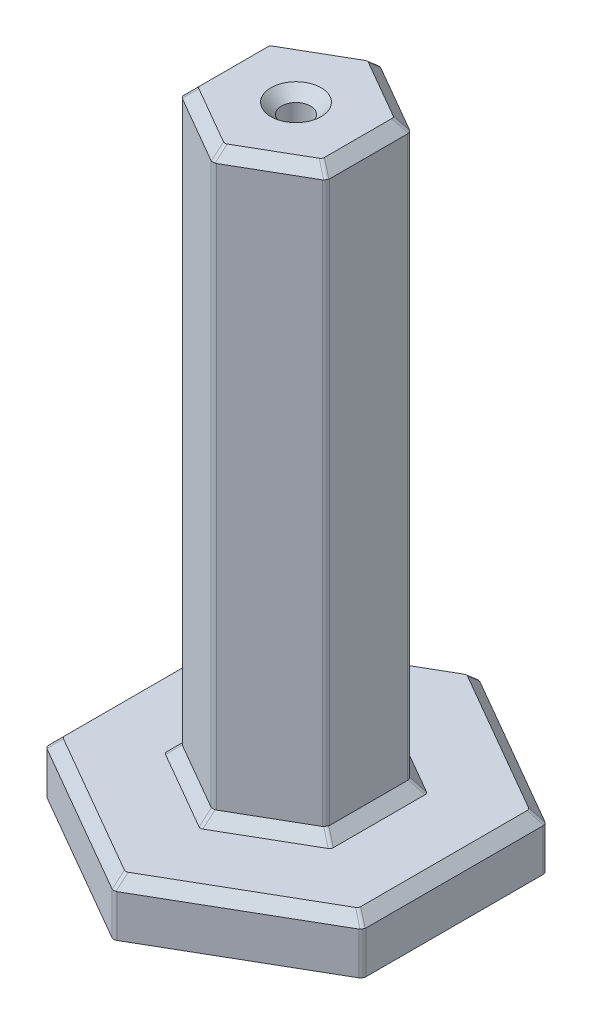
from build123d import *

# Parameters (mm, degrees)
BOSS_EXTRUDE1_DEPTH = 60
BOSS_EXTRUDE2_DEPTH = 5
SKETCH5_R           = 1.375
CUT_EXTRUDE2_DEPTH  = 15
CHAMFER1_SIZE       = 1
FILLET2_R           = 0.5


with BuildPart() as part:
    # Sketch2 → Boss-Extrude1 (new body)
    with BuildSketch(Plane(origin=(0, 0, 0), x_dir=(1, 0, 0), z_dir=(0, 1, 0))):
        Polygon((-6.875, 3.969283101), (-6.875, -3.969283101), (0, -7.938566201), (6.875, -3.969283101), (6.875, 3.969283101), (0, 7.938566201), align=None)
    extrude(amount=BOSS_EXTRUDE1_DEPTH)

    # Sketch2<3> → Boss-Extrude2 (add)
    with BuildSketch(Plane(origin=(0, 0, 0), x_dir=(1, 0, 0), z_dir=(0, 1, 0))):
        Polygon((0, -17.320508076), (15, -8.660254038), (15, 8.660254038), (0, 17.320508076), (-15, 8.660254038), (-15, -8.660254038), align=None)
        Polygon((0, -7.938566201), (6.875, -3.969283101), (6.875, 3.969283101), (0, 7.938566201), (-6.875, 3.969283101), (-6.875, -3.969283101), align=None, mode=Mode.SUBTRACT)
    extrude(amount=BOSS_EXTRUDE2_DEPTH)

    # Sketch5 → Cut-Extrude2 (cut)
    with BuildSketch(Plane(origin=(0, 60, 0), x_dir=(1, 0, 0), z_dir=(0, 1, 0))):
        with Locations(Location((0, 0, 0), (0, 0, 270))):
            Circle(SKETCH5_R)
    extrude(amount=-CUT_EXTRUDE2_DEPTH, mode=Mode.SUBTRACT)

    # Chamfer1
    chamfer1_edges = [part.edges().sort_by_distance(p)[0] for p in [
        (-3.4375, 60, 5.953924651),
        (3.4375, 60, 5.953924651),
        (6.875, 60, 0),
        (-7.5, 5, 12.990381057),
        (7.5, 5, 12.990381057),
        (15, 5, 0),
        (3.4375, 60, -5.953924651),
        (7.5, 5, -12.990381057),
        (-7.5, 5, -12.990381057),
        (-15, 5, 0),
        (-3.4375, 60, -5.953924651),
        (-3.4375, 5, 5.953924651),
        (3.4375, 5, 5.953924651),
        (6.875, 5, 0),
        (3.4375, 5, -5.953924651),
        (-3.4375, 5, -5.953924651),
        (-6.875, 5, 0),
        (0, 60, -1.375),
        (-6.875, 60, 0),
    ]]
    chamfer(chamfer1_edges, length=CHAMFER1_SIZE)

    # Fillet2
    # the kernel refuses this fillet: 0.5 mm, written as the material it takes off along each edge
    with BuildSketch(Plane(origin=(0, 4.690705213, 9.450409597), x_dir=(-0.9354143466934874, -0.26726124191242123, -0.2314550249431329), z_dir=(-2.1820492742108273e-15, 0.6546536707079779, -0.7559289460184538))) as fillet2_piece_1_section:
        with BuildLine():
            CenterArc((FILLET2_R * 0.377964473009, -FILLET2_R), FILLET2_R, 90, 41.409622109)
            Line((-FILLET2_R * 0.283473354757, -FILLET2_R * 0.25), (0, 0))
            Line((0, 0), (FILLET2_R * 0.377964473009, 0))
        make_face()
    fillet2_piece_1 = extrude(amount=2.472436414, mode=Mode.PRIVATE)
    fillet2_piece_1 = split(fillet2_piece_1, bisect_by=Plane(origin=(0.249012308, 5.466076013, 8.082333524), z_dir=(-0.4999999999999949, 0, 0.8660254037844416)), keep=Keep.TOP, mode=Mode.PRIVATE)
    fillet2_piece_1 = split(fillet2_piece_1, bisect_by=Plane(origin=(-0.249012308, 5.466076013, 8.082333524), z_dir=(0.500000000000001, 0, 0.8660254037844382)), keep=Keep.TOP, mode=Mode.PRIVATE)
    fillet2_piece_1 = split(fillet2_piece_1, bisect_by=Plane(origin=(0, 5, 8.513635494), z_dir=(0, 1, 0)), keep=Keep.TOP, mode=Mode.PRIVATE)
    add(fillet2_piece_1, mode=Mode.SUBTRACT)
    with BuildSketch(Plane(origin=(0, 4.690705213, 9.450409597), x_dir=(-0.9354143466934874, -0.26726124191242123, -0.2314550249431329), z_dir=(-2.1820492742108273e-15, 0.6546536707079779, -0.7559289460184538))) as fillet2_piece_2_section:
        with BuildLine():
            CenterArc((FILLET2_R * 0.377964473009, -FILLET2_R), FILLET2_R, 90, 41.409622109)
            Line((-FILLET2_R * 0.283473354757, -FILLET2_R * 0.25), (0, 0))
            Line((0, 0), (FILLET2_R * 0.377964473009, 0))
        make_face()
    fillet2_piece_2 = extrude(amount=2.472436414, mode=Mode.PRIVATE)
    fillet2_piece_2 = split(fillet2_piece_2, bisect_by=Plane(origin=(0.076667017, 5.950234489, 7.982829924), z_dir=(0.4999999999999949, 0, -0.8660254037844416)), keep=Keep.TOP, mode=Mode.PRIVATE)
    fillet2_piece_2 = split(fillet2_piece_2, bisect_by=Plane(origin=(0.07666702, 5.950234489, 7.894302477), z_dir=(0.500000000000001, 0, 0.8660254037844382)), keep=Keep.TOP, mode=Mode.PRIVATE)
    add(fillet2_piece_2, mode=Mode.SUBTRACT)
    with BuildSketch(Plane(origin=(0, 4.690705213, 9.450409597), x_dir=(-0.9354143466934874, -0.26726124191242123, -0.2314550249431329), z_dir=(-2.1820492742108273e-15, 0.6546536707079779, -0.7559289460184538))) as fillet2_piece_3_section:
        with BuildLine():
            CenterArc((FILLET2_R * 0.377964473009, -FILLET2_R), FILLET2_R, 90, 41.409622109)
            Line((-FILLET2_R * 0.283473354757, -FILLET2_R * 0.25), (0, 0))
            Line((0, 0), (FILLET2_R * 0.377964473009, 0))
        make_face()
    fillet2_piece_3 = extrude(amount=2.472436414, mode=Mode.PRIVATE)
    fillet2_piece_3 = split(fillet2_piece_3, bisect_by=Plane(origin=(-0.07666702, 5.950234489, 7.894302477), z_dir=(-0.4999999999999949, 0, 0.8660254037844416)), keep=Keep.TOP, mode=Mode.PRIVATE)
    fillet2_piece_3 = split(fillet2_piece_3, bisect_by=Plane(origin=(-0.076667017, 5.950234489, 7.982829924), z_dir=(-0.500000000000001, 0, -0.8660254037844382)), keep=Keep.TOP, mode=Mode.PRIVATE)
    add(fillet2_piece_3, mode=Mode.SUBTRACT)
    with BuildSketch(Plane(origin=(0, 4.690705213, -9.450409597), x_dir=(-0.9354143466934844, -0.26726124191242323, 0.23145502494314288), z_dir=(4.951573353016852e-15, 0.654653670707977, 0.7559289460184546))) as fillet2_piece_4_section:
        with BuildLine():
            CenterArc((FILLET2_R * 0.377964473009, FILLET2_R), FILLET2_R, 228.590377891, 41.409622109)
            Line((-FILLET2_R * 0.283473354757, FILLET2_R * 0.25), (0, 0))
            Line((0, 0), (FILLET2_R * 0.377964473009, 0))
        make_face()
    fillet2_piece_4 = extrude(amount=2.472436414, mode=Mode.PRIVATE)
    fillet2_piece_4 = split(fillet2_piece_4, bisect_by=Plane(origin=(0.249012308, 5.466076013, -8.082333524), z_dir=(-0.500000000000007, 0, -0.8660254037844347)), keep=Keep.TOP, mode=Mode.PRIVATE)
    fillet2_piece_4 = split(fillet2_piece_4, bisect_by=Plane(origin=(0, 5, -8.513635494), z_dir=(0, 1, 0)), keep=Keep.TOP, mode=Mode.PRIVATE)
    fillet2_piece_4 = split(fillet2_piece_4, bisect_by=Plane(origin=(-0.249012308, 5.466076013, -8.082333524), z_dir=(0.4999999999999948, 0, -0.8660254037844417)), keep=Keep.TOP, mode=Mode.PRIVATE)
    add(fillet2_piece_4, mode=Mode.SUBTRACT)
    with BuildSketch(Plane(origin=(0, 4.690705213, -9.450409597), x_dir=(-0.9354143466934844, -0.26726124191242323, 0.23145502494314288), z_dir=(4.951573353016852e-15, 0.654653670707977, 0.7559289460184546))) as fillet2_piece_5_section:
        with BuildLine():
            CenterArc((FILLET2_R * 0.377964473009, FILLET2_R), FILLET2_R, 228.590377891, 41.409622109)
            Line((-FILLET2_R * 0.283473354757, FILLET2_R * 0.25), (0, 0))
            Line((0, 0), (FILLET2_R * 0.377964473009, 0))
        make_face()
    fillet2_piece_5 = extrude(amount=2.472436414, mode=Mode.PRIVATE)
    fillet2_piece_5 = split(fillet2_piece_5, bisect_by=Plane(origin=(0.076667017, 5.950234489, -7.982829924), z_dir=(0.500000000000007, 0, 0.8660254037844347)), keep=Keep.TOP, mode=Mode.PRIVATE)
    fillet2_piece_5 = split(fillet2_piece_5, bisect_by=Plane(origin=(0.07666702, 5.950234489, -7.894302477), z_dir=(0.4999999999999948, 0, -0.8660254037844417)), keep=Keep.TOP, mode=Mode.PRIVATE)
    add(fillet2_piece_5, mode=Mode.SUBTRACT)
    with BuildSketch(Plane(origin=(0, 4.690705213, -9.450409597), x_dir=(-0.9354143466934844, -0.26726124191242323, 0.23145502494314288), z_dir=(4.951573353016852e-15, 0.654653670707977, 0.7559289460184546))) as fillet2_piece_6_section:
        with BuildLine():
            CenterArc((FILLET2_R * 0.377964473009, FILLET2_R), FILLET2_R, 228.590377891, 41.409622109)
            Line((-FILLET2_R * 0.283473354757, FILLET2_R * 0.25), (0, 0))
            Line((0, 0), (FILLET2_R * 0.377964473009, 0))
        make_face()
    fillet2_piece_6 = extrude(amount=2.472436414, mode=Mode.PRIVATE)
    fillet2_piece_6 = split(fillet2_piece_6, bisect_by=Plane(origin=(-0.07666702, 5.950234489, -7.894302477), z_dir=(-0.500000000000007, 0, -0.8660254037844347)), keep=Keep.TOP, mode=Mode.PRIVATE)
    fillet2_piece_6 = split(fillet2_piece_6, bisect_by=Plane(origin=(-0.076667017, 5.950234489, -7.982829924), z_dir=(-0.4999999999999948, 0, 0.8660254037844417)), keep=Keep.TOP, mode=Mode.PRIVATE)
    add(fillet2_piece_6, mode=Mode.SUBTRACT)
    with BuildSketch(Plane(origin=(8.184294787, 4.690705213, 4.725204798), x_dir=(-0.6681531047810594, -0.2672612419124249, 0.694365074829415), z_dir=(-0.6546536707079783, 0.6546536707079771, -0.3779644730092256))) as fillet2_piece_7_section:
        with BuildLine():
            CenterArc((FILLET2_R * 0.377964473009, -FILLET2_R), FILLET2_R, 90, 41.409622109)
            Line((-FILLET2_R * 0.283473354757, -FILLET2_R * 0.25), (0, 0))
            Line((0, 0), (FILLET2_R * 0.377964473009, 0))
        make_face()
    fillet2_piece_7 = extrude(amount=2.472436414, mode=Mode.PRIVATE)
    fillet2_piece_7 = split(fillet2_piece_7, bisect_by=Plane(origin=(7.124012308, 5.466076013, 3.825515778), z_dir=(0.500000000000001, 0, 0.8660254037844382)), keep=Keep.TOP, mode=Mode.PRIVATE)
    fillet2_piece_7 = split(fillet2_piece_7, bisect_by=Plane(origin=(7.373024616, 5, 4.256817747), z_dir=(0, 1, 0)), keep=Keep.TOP, mode=Mode.PRIVATE)
    fillet2_piece_7 = split(fillet2_piece_7, bisect_by=Plane(origin=(6.875, 5.466076013, 4.256817747), z_dir=(1, 0, 0)), keep=Keep.TOP, mode=Mode.PRIVATE)
    add(fillet2_piece_7, mode=Mode.SUBTRACT)
    with BuildSketch(Plane(origin=(8.184294787, 4.690705213, 4.725204798), x_dir=(-0.6681531047810594, -0.2672612419124249, 0.694365074829415), z_dir=(-0.6546536707079783, 0.6546536707079771, -0.3779644730092256))) as fillet2_piece_8_section:
        with BuildLine():
            CenterArc((FILLET2_R * 0.377964473009, -FILLET2_R), FILLET2_R, 90, 41.409622109)
            Line((-FILLET2_R * 0.283473354757, -FILLET2_R * 0.25), (0, 0))
            Line((0, 0), (FILLET2_R * 0.377964473009, 0))
        make_face()
    fillet2_piece_8 = extrude(amount=2.472436414, mode=Mode.PRIVATE)
    fillet2_piece_8 = split(fillet2_piece_8, bisect_by=Plane(origin=(6.951667017, 5.950234489, 3.925019378), z_dir=(-0.500000000000001, 0, -0.8660254037844382)), keep=Keep.TOP, mode=Mode.PRIVATE)
    fillet2_piece_8 = split(fillet2_piece_8, bisect_by=Plane(origin=(6.875, 5.950234489, 3.880755652), z_dir=(1, 0, 0)), keep=Keep.TOP, mode=Mode.PRIVATE)
    add(fillet2_piece_8, mode=Mode.SUBTRACT)
    with BuildSketch(Plane(origin=(8.184294787, 4.690705213, 4.725204798), x_dir=(-0.6681531047810594, -0.2672612419124249, 0.694365074829415), z_dir=(-0.6546536707079783, 0.6546536707079771, -0.3779644730092256))) as fillet2_piece_9_section:
        with BuildLine():
            CenterArc((FILLET2_R * 0.377964473009, -FILLET2_R), FILLET2_R, 90, 41.409622109)
            Line((-FILLET2_R * 0.283473354757, -FILLET2_R * 0.25), (0, 0))
            Line((0, 0), (FILLET2_R * 0.377964473009, 0))
        make_face()
    fillet2_piece_9 = extrude(amount=2.472436414, mode=Mode.PRIVATE)
    fillet2_piece_9 = split(fillet2_piece_9, bisect_by=Plane(origin=(6.79833298, 5.950234489, 4.013546825), z_dir=(0.500000000000001, 0, 0.8660254037844382)), keep=Keep.TOP, mode=Mode.PRIVATE)
    fillet2_piece_9 = split(fillet2_piece_9, bisect_by=Plane(origin=(6.875, 5.950234489, 4.057810547), z_dir=(-1, 0, 0)), keep=Keep.TOP, mode=Mode.PRIVATE)
    add(fillet2_piece_9, mode=Mode.SUBTRACT)
    with BuildSketch(Plane(origin=(8.184294787, 4.690705213, -4.725204798), x_dir=(-0.668153104781066, -0.2672612419124279, -0.6943650748294075), z_dir=(-0.6546536707079755, 0.6546536707079769, 0.3779644730092306))) as fillet2_piece_10_section:
        with BuildLine():
            CenterArc((FILLET2_R * 0.377964473009, FILLET2_R), FILLET2_R, 228.590377891, 41.409622109)
            Line((-FILLET2_R * 0.283473354757, FILLET2_R * 0.25), (0, 0))
            Line((0, 0), (FILLET2_R * 0.377964473009, 0))
        make_face()
    fillet2_piece_10 = extrude(amount=2.472436414, mode=Mode.PRIVATE)
    fillet2_piece_10 = split(fillet2_piece_10, bisect_by=Plane(origin=(7.373024616, 5, -4.256817747), z_dir=(0, 1, 0)), keep=Keep.TOP, mode=Mode.PRIVATE)
    fillet2_piece_10 = split(fillet2_piece_10, bisect_by=Plane(origin=(7.124012308, 5.466076013, -3.825515778), z_dir=(0.4999999999999948, 0, -0.8660254037844417)), keep=Keep.TOP, mode=Mode.PRIVATE)
    fillet2_piece_10 = split(fillet2_piece_10, bisect_by=Plane(origin=(6.875, 5.466076013, -4.256817747), z_dir=(1, 0, 0)), keep=Keep.TOP, mode=Mode.PRIVATE)
    add(fillet2_piece_10, mode=Mode.SUBTRACT)
    with BuildSketch(Plane(origin=(8.184294787, 4.690705213, -4.725204798), x_dir=(-0.668153104781066, -0.2672612419124279, -0.6943650748294075), z_dir=(-0.6546536707079755, 0.6546536707079769, 0.3779644730092306))) as fillet2_piece_11_section:
        with BuildLine():
            CenterArc((FILLET2_R * 0.377964473009, FILLET2_R), FILLET2_R, 228.590377891, 41.409622109)
            Line((-FILLET2_R * 0.283473354757, FILLET2_R * 0.25), (0, 0))
            Line((0, 0), (FILLET2_R * 0.377964473009, 0))
        make_face()
    fillet2_piece_11 = extrude(amount=2.472436414, mode=Mode.PRIVATE)
    fillet2_piece_11 = split(fillet2_piece_11, bisect_by=Plane(origin=(6.951667017, 5.950234489, -3.925019378), z_dir=(-0.4999999999999948, 0, 0.8660254037844417)), keep=Keep.TOP, mode=Mode.PRIVATE)
    fillet2_piece_11 = split(fillet2_piece_11, bisect_by=Plane(origin=(6.875, 5.950234489, -3.880755652), z_dir=(1, 0, 0)), keep=Keep.TOP, mode=Mode.PRIVATE)
    add(fillet2_piece_11, mode=Mode.SUBTRACT)
    with BuildSketch(Plane(origin=(8.184294787, 4.690705213, -4.725204798), x_dir=(-0.668153104781066, -0.2672612419124279, -0.6943650748294075), z_dir=(-0.6546536707079755, 0.6546536707079769, 0.3779644730092306))) as fillet2_piece_12_section:
        with BuildLine():
            CenterArc((FILLET2_R * 0.377964473009, FILLET2_R), FILLET2_R, 228.590377891, 41.409622109)
            Line((-FILLET2_R * 0.283473354757, FILLET2_R * 0.25), (0, 0))
            Line((0, 0), (FILLET2_R * 0.377964473009, 0))
        make_face()
    fillet2_piece_12 = extrude(amount=2.472436414, mode=Mode.PRIVATE)
    fillet2_piece_12 = split(fillet2_piece_12, bisect_by=Plane(origin=(6.79833298, 5.950234489, -4.013546825), z_dir=(0.4999999999999948, 0, -0.8660254037844417)), keep=Keep.TOP, mode=Mode.PRIVATE)
    fillet2_piece_12 = split(fillet2_piece_12, bisect_by=Plane(origin=(6.875, 5.950234489, -4.057810547), z_dir=(-1, 0, 0)), keep=Keep.TOP, mode=Mode.PRIVATE)
    add(fillet2_piece_12, mode=Mode.SUBTRACT)
    with BuildSketch(Plane(origin=(13.690705213, 5.309294787, -7.90433234), x_dir=(0.2672612419124219, -0.2672612419124266, 0.9258200997725515), z_dir=(0.6546536707079772, -0.6546536707079772, -0.3779644730092271)), Plane(origin=(13.690705213, 5.309294787, 7.90433234), x_dir=(-0.6681531047810609, -0.2672612419124254, 0.6943650748294132), z_dir=(0.6546536707079774, -0.6546536707079774, 0.3779644730092266)), Plane(origin=(0, 5.309294787, 15.80866468), x_dir=(-0.9354143466934843, -0.26726124191242595, -0.23145502494314005), z_dir=(0, -0.6546536707079774, 0.7559289460184544)), Plane(origin=(5.565705213, 60.309294787, 3.213361403), x_dir=(-0.6681531047810593, -0.2672612419124241, 0.6943650748294152), z_dir=(0.6546536707079782, -0.6546536707079769, 0.3779644730092261))) as fillet2_piece_13:
        with BuildLine():
            CenterArc((FILLET2_R * 0.377964473009, FILLET2_R), FILLET2_R, 228.590377891, 41.409622109)
            Line((-FILLET2_R * 0.283473354757, FILLET2_R * 0.25), (0, 0))
            Line((0, 0), (FILLET2_R * 0.377964473009, 0))
        make_face()
    extrude(amount=2.472436414, mode=Mode.SUBTRACT)
    with BuildSketch(Plane(origin=(0, 5.309294787, -15.80866468), x_dir=(-0.9354143466934823, -0.2672612419124306, 0.2314550249431426), z_dir=(0, -0.6546536707079775, -0.7559289460184543)), Plane(origin=(-13.690705213, 5.309294787, -7.90433234), x_dir=(-0.2672612419124262, -0.26726124191242145, 0.9258200997725518), z_dir=(-0.6546536707079774, -0.6546536707079773, -0.3779644730092264)), Plane(origin=(-13.690705213, 5.309294787, 7.90433234), x_dir=(0.6681531047810614, -0.26726124191242584, 0.6943650748294126), z_dir=(-0.6546536707079773, -0.6546536707079773, 0.377964473009227)), Plane(origin=(0, 58.690705213, 8.295709059), x_dir=(-0.9354143466934889, -0.2672612419124191, -0.23145502494313003), z_dir=(-2.937374022976115e-15, 0.6546536707079778, -0.7559289460184541)), Plane(origin=(5.565705213, 60.309294787, -3.213361403), x_dir=(-0.6681531047810663, -0.2672612419124284, -0.6943650748294069), z_dir=(0.6546536707079755, -0.6546536707079768, -0.37796447300923064)), Plane(origin=(-7.184294787, 58.690705213, 4.147854529), x_dir=(-0.2672612419124373, -0.26726124191241846, -0.9258200997725494), z_dir=(0.6546536707079738, 0.6546536707079778, -0.37796447300923225)), Plane(origin=(0, 60.309294787, -6.426722806), x_dir=(-0.9354143466934819, -0.26726124191242834, 0.23145502494314776), z_dir=(-5.37119821344201e-15, -0.6546536707079769, -0.7559289460184547)), Plane(origin=(-5.565705213, 60.309294787, -3.213361403), x_dir=(-0.2672612419123992, -0.2672612419124415, 0.9258200997725538), z_dir=(-0.6546536707079809, -0.6546536707079769, -0.37796447300922154))) as fillet2_piece_14:
        with BuildLine():
            CenterArc((FILLET2_R * 0.377964473009, -FILLET2_R), FILLET2_R, 90, 41.409622109)
            Line((-FILLET2_R * 0.283473354757, -FILLET2_R * 0.25), (0, 0))
            Line((0, 0), (FILLET2_R * 0.377964473009, 0))
        make_face()
    extrude(amount=2.472436414, mode=Mode.SUBTRACT)
    with BuildSketch(Plane(origin=(0, 5.278312164, -7.938566201), x_dir=(-0.8660254037844356, 0, 0.5000000000000054), z_dir=(0, 1, 0))) as fillet2_piece_15_section:
        with BuildLine():
            CenterArc((FILLET2_R * 0.57735026919, FILLET2_R), FILLET2_R, 210, 60)
            Line((-FILLET2_R * 0.288675134595, FILLET2_R * 0.5), (0, 0))
            Line((0, 0), (FILLET2_R * 0.57735026919, 0))
        make_face()
    fillet2_piece_15 = extrude(amount=54.443375673, mode=Mode.PRIVATE)
    fillet2_piece_15 = split(fillet2_piece_15, bisect_by=Plane(origin=(0.115977803, 6.104504895, -7.884854159), z_dir=(0.3535533905932788, -0.7071067811865475, 0.6123724356957917)), keep=Keep.TOP, mode=Mode.PRIVATE)
    fillet2_piece_15 = split(fillet2_piece_15, bisect_by=Plane(origin=(0.115977803, 6.038231864, -7.827460031), z_dir=(0.35355339059327007, 0.7071067811865476, -0.6123724356957966)), keep=Keep.TOP, mode=Mode.PRIVATE)
    add(fillet2_piece_15, mode=Mode.SUBTRACT)
    with BuildSketch(Plane(origin=(0, 5.278312164, -7.938566201), x_dir=(-0.8660254037844356, 0, 0.5000000000000054), z_dir=(0, 1, 0))) as fillet2_piece_16_section:
        with BuildLine():
            CenterArc((FILLET2_R * 0.57735026919, FILLET2_R), FILLET2_R, 210, 60)
            Line((-FILLET2_R * 0.288675134595, FILLET2_R * 0.5), (0, 0))
            Line((0, 0), (FILLET2_R * 0.57735026919, 0))
        make_face()
    fillet2_piece_16 = extrude(amount=54.443375673, mode=Mode.PRIVATE)
    fillet2_piece_16 = split(fillet2_piece_16, bisect_by=Plane(origin=(-0.115977803, 6.038231864, -7.827460031), z_dir=(-0.3535533905932788, 0.7071067811865475, -0.6123724356957917)), keep=Keep.TOP, mode=Mode.PRIVATE)
    fillet2_piece_16 = split(fillet2_piece_16, bisect_by=Plane(origin=(-0.115977803, 6.104504895, -7.884854159), z_dir=(-0.35355339059327007, -0.7071067811865476, 0.6123724356957966)), keep=Keep.TOP, mode=Mode.PRIVATE)
    add(fillet2_piece_16, mode=Mode.SUBTRACT)
    with BuildSketch(Plane(origin=(0, 5.278312164, -7.938566201), x_dir=(-0.8660254037844356, 0, 0.5000000000000054), z_dir=(0, 1, 0))) as fillet2_piece_17_section:
        with BuildLine():
            CenterArc((FILLET2_R * 0.57735026919, FILLET2_R), FILLET2_R, 210, 60)
            Line((-FILLET2_R * 0.288675134595, FILLET2_R * 0.5), (0, 0))
            Line((0, 0), (FILLET2_R * 0.57735026919, 0))
        make_face()
    fillet2_piece_17 = extrude(amount=54.443375673, mode=Mode.PRIVATE)
    fillet2_piece_17 = split(fillet2_piece_17, bisect_by=Plane(origin=(6.713628494, 19.481396387, 3.752294247), z_dir=(-0.3535533905932788, 0.7071067811865475, -0.6123724356957917)), keep=Keep.TOP, mode=Mode.PRIVATE)
    fillet2_piece_17 = split(fillet2_piece_17, bisect_by=Plane(origin=(-6.713628494, 19.481396387, 3.752294247), z_dir=(0.35355339059327007, 0.7071067811865476, -0.6123724356957966)), keep=Keep.TOP, mode=Mode.PRIVATE)
    add(fillet2_piece_17, mode=Mode.SUBTRACT)
    with BuildSketch(Plane(origin=(-6.875, 5.278312164, -3.969283101), x_dir=(0, 0, 1), z_dir=(0, 1, 0))) as fillet2_piece_18_section:
        with BuildLine():
            CenterArc((FILLET2_R * 0.57735026919, FILLET2_R), FILLET2_R, 210, 60)
            Line((-FILLET2_R * 0.288675134595, FILLET2_R * 0.5), (0, 0))
            Line((0, 0), (FILLET2_R * 0.57735026919, 0))
        make_face()
    fillet2_piece_18 = extrude(amount=54.443375673, mode=Mode.PRIVATE)
    fillet2_piece_18 = split(fillet2_piece_18, bisect_by=Plane(origin=(-6.770495105, 6.104504895, -4.042866803), z_dir=(0.7071067811865476, -0.7071067811865476, -7.358336291174564e-15)), keep=Keep.TOP, mode=Mode.PRIVATE)
    fillet2_piece_18 = split(fillet2_piece_18, bisect_by=Plane(origin=(-6.720790333, 6.038231864, -4.014169739), z_dir=(-0.3535533905932788, 0.7071067811865475, -0.6123724356957917)), keep=Keep.TOP, mode=Mode.PRIVATE)
    add(fillet2_piece_18, mode=Mode.SUBTRACT)
    with BuildSketch(Plane(origin=(-6.875, 5.278312164, -3.969283101), x_dir=(0, 0, 1), z_dir=(0, 1, 0))) as fillet2_piece_19_section:
        with BuildLine():
            CenterArc((FILLET2_R * 0.57735026919, FILLET2_R), FILLET2_R, 210, 60)
            Line((-FILLET2_R * 0.288675134595, FILLET2_R * 0.5), (0, 0))
            Line((0, 0), (FILLET2_R * 0.57735026919, 0))
        make_face()
    fillet2_piece_19 = extrude(amount=54.443375673, mode=Mode.PRIVATE)
    fillet2_piece_19 = split(fillet2_piece_19, bisect_by=Plane(origin=(-6.836768136, 6.038231864, -3.813290292), z_dir=(-0.7071067811865476, 0.7071067811865476, 7.358336291174564e-15)), keep=Keep.TOP, mode=Mode.PRIVATE)
    fillet2_piece_19 = split(fillet2_piece_19, bisect_by=Plane(origin=(-6.886472909, 6.104504895, -3.841987356), z_dir=(0.3535533905932788, -0.7071067811865475, 0.6123724356957917)), keep=Keep.TOP, mode=Mode.PRIVATE)
    add(fillet2_piece_19, mode=Mode.SUBTRACT)
    with BuildSketch(Plane(origin=(-6.875, 5.278312164, -3.969283101), x_dir=(0, 0, 1), z_dir=(0, 1, 0))) as fillet2_piece_20_section:
        with BuildLine():
            CenterArc((FILLET2_R * 0.57735026919, FILLET2_R), FILLET2_R, 210, 60)
            Line((-FILLET2_R * 0.288675134595, FILLET2_R * 0.5), (0, 0))
            Line((0, 0), (FILLET2_R * 0.57735026919, 0))
        make_face()
    fillet2_piece_20 = extrude(amount=54.443375673, mode=Mode.PRIVATE)
    fillet2_piece_20 = split(fillet2_piece_20, bisect_by=Plane(origin=(6.606396387, 19.481396387, -3.938025704), z_dir=(-0.7071067811865476, 0.7071067811865476, 7.358336291174564e-15)), keep=Keep.TOP, mode=Mode.PRIVATE)
    fillet2_piece_20 = split(fillet2_piece_20, bisect_by=Plane(origin=(-0.107232107, 19.481396387, 7.690319951), z_dir=(-0.3535533905932788, 0.7071067811865475, -0.6123724356957917)), keep=Keep.TOP, mode=Mode.PRIVATE)
    add(fillet2_piece_20, mode=Mode.SUBTRACT)
    with BuildSketch(Plane(origin=(6.875, 5.278312164, -3.969283101), x_dir=(-0.866025403784442, 0, -0.4999999999999941), z_dir=(0, 1, 0))) as fillet2_piece_21_section:
        with BuildLine():
            CenterArc((FILLET2_R * 0.57735026919, FILLET2_R), FILLET2_R, 210, 60)
            Line((-FILLET2_R * 0.288675134595, FILLET2_R * 0.5), (0, 0))
            Line((0, 0), (FILLET2_R * 0.57735026919, 0))
        make_face()
    fillet2_piece_21 = extrude(amount=54.443375673, mode=Mode.PRIVATE)
    fillet2_piece_21 = split(fillet2_piece_21, bisect_by=Plane(origin=(6.886472909, 6.104504895, -3.841987356), z_dir=(-0.35355339059327007, -0.7071067811865476, 0.6123724356957966)), keep=Keep.TOP, mode=Mode.PRIVATE)
    fillet2_piece_21 = split(fillet2_piece_21, bisect_by=Plane(origin=(6.836768136, 6.038231864, -3.813290292), z_dir=(0.7071067811865476, 0.7071067811865476, -2.4667946423747115e-15)), keep=Keep.TOP, mode=Mode.PRIVATE)
    add(fillet2_piece_21, mode=Mode.SUBTRACT)
    with BuildSketch(Plane(origin=(6.875, 5.278312164, -3.969283101), x_dir=(-0.866025403784442, 0, -0.4999999999999941), z_dir=(0, 1, 0))) as fillet2_piece_22_section:
        with BuildLine():
            CenterArc((FILLET2_R * 0.57735026919, FILLET2_R), FILLET2_R, 210, 60)
            Line((-FILLET2_R * 0.288675134595, FILLET2_R * 0.5), (0, 0))
            Line((0, 0), (FILLET2_R * 0.57735026919, 0))
        make_face()
    fillet2_piece_22 = extrude(amount=54.443375673, mode=Mode.PRIVATE)
    fillet2_piece_22 = split(fillet2_piece_22, bisect_by=Plane(origin=(6.720790333, 6.038231864, -4.014169739), z_dir=(0.35355339059327007, 0.7071067811865476, -0.6123724356957966)), keep=Keep.TOP, mode=Mode.PRIVATE)
    fillet2_piece_22 = split(fillet2_piece_22, bisect_by=Plane(origin=(6.770495105, 6.104504895, -4.042866803), z_dir=(-0.7071067811865476, -0.7071067811865476, 2.4667946423747115e-15)), keep=Keep.TOP, mode=Mode.PRIVATE)
    add(fillet2_piece_22, mode=Mode.SUBTRACT)
    with BuildSketch(Plane(origin=(6.875, 5.278312164, -3.969283101), x_dir=(-0.866025403784442, 0, -0.4999999999999941), z_dir=(0, 1, 0))) as fillet2_piece_23_section:
        with BuildLine():
            CenterArc((FILLET2_R * 0.57735026919, FILLET2_R), FILLET2_R, 210, 60)
            Line((-FILLET2_R * 0.288675134595, FILLET2_R * 0.5), (0, 0))
            Line((0, 0), (FILLET2_R * 0.57735026919, 0))
        make_face()
    fillet2_piece_23 = extrude(amount=54.443375673, mode=Mode.PRIVATE)
    fillet2_piece_23 = split(fillet2_piece_23, bisect_by=Plane(origin=(0.107232107, 19.481396387, 7.690319951), z_dir=(0.35355339059327007, 0.7071067811865476, -0.6123724356957966)), keep=Keep.TOP, mode=Mode.PRIVATE)
    fillet2_piece_23 = split(fillet2_piece_23, bisect_by=Plane(origin=(-6.606396387, 19.481396387, -3.938025704), z_dir=(0.7071067811865476, 0.7071067811865476, -2.4667946423747115e-15)), keep=Keep.TOP, mode=Mode.PRIVATE)
    add(fillet2_piece_23, mode=Mode.SUBTRACT)
    with BuildSketch(Plane(origin=(6.875, 5.278312164, 3.969283101), x_dir=(-0.8660254037844378, 0, 0.5000000000000014), z_dir=(0, 1, 0))) as fillet2_piece_24_section:
        with BuildLine():
            CenterArc((FILLET2_R * 0.57735026919, -FILLET2_R), FILLET2_R, 90, 60)
            Line((-FILLET2_R * 0.288675134595, -FILLET2_R * 0.5), (0, 0))
            Line((0, 0), (FILLET2_R * 0.57735026919, 0))
        make_face()
    fillet2_piece_24 = extrude(amount=54.443375673, mode=Mode.PRIVATE)
    fillet2_piece_24 = split(fillet2_piece_24, bisect_by=Plane(origin=(6.886472909, 6.104504895, 3.841987356), z_dir=(-0.3535533905932744, -0.7071067811865475, -0.6123724356957944)), keep=Keep.TOP, mode=Mode.PRIVATE)
    fillet2_piece_24 = split(fillet2_piece_24, bisect_by=Plane(origin=(6.836768136, 6.038231864, 3.813290292), z_dir=(0.7071067811865476, 0.7071067811865476, -2.4667946423747115e-15)), keep=Keep.TOP, mode=Mode.PRIVATE)
    add(fillet2_piece_24, mode=Mode.SUBTRACT)
    with BuildSketch(Plane(origin=(6.875, 5.278312164, 3.969283101), x_dir=(-0.8660254037844378, 0, 0.5000000000000014), z_dir=(0, 1, 0))) as fillet2_piece_25_section:
        with BuildLine():
            CenterArc((FILLET2_R * 0.57735026919, -FILLET2_R), FILLET2_R, 90, 60)
            Line((-FILLET2_R * 0.288675134595, -FILLET2_R * 0.5), (0, 0))
            Line((0, 0), (FILLET2_R * 0.57735026919, 0))
        make_face()
    fillet2_piece_25 = extrude(amount=54.443375673, mode=Mode.PRIVATE)
    fillet2_piece_25 = split(fillet2_piece_25, bisect_by=Plane(origin=(6.720790333, 6.038231864, 4.014169739), z_dir=(0.3535533905932744, 0.7071067811865475, 0.6123724356957944)), keep=Keep.TOP, mode=Mode.PRIVATE)
    fillet2_piece_25 = split(fillet2_piece_25, bisect_by=Plane(origin=(6.770495105, 6.104504895, 4.042866803), z_dir=(-0.7071067811865476, -0.7071067811865476, 2.4667946423747115e-15)), keep=Keep.TOP, mode=Mode.PRIVATE)
    add(fillet2_piece_25, mode=Mode.SUBTRACT)
    with BuildSketch(Plane(origin=(6.875, 5.278312164, 3.969283101), x_dir=(-0.8660254037844378, 0, 0.5000000000000014), z_dir=(0, 1, 0))) as fillet2_piece_26_section:
        with BuildLine():
            CenterArc((FILLET2_R * 0.57735026919, -FILLET2_R), FILLET2_R, 90, 60)
            Line((-FILLET2_R * 0.288675134595, -FILLET2_R * 0.5), (0, 0))
            Line((0, 0), (FILLET2_R * 0.57735026919, 0))
        make_face()
    fillet2_piece_26 = extrude(amount=54.443375673, mode=Mode.PRIVATE)
    fillet2_piece_26 = split(fillet2_piece_26, bisect_by=Plane(origin=(0.107232107, 19.481396387, -7.690319951), z_dir=(0.3535533905932744, 0.7071067811865475, 0.6123724356957944)), keep=Keep.TOP, mode=Mode.PRIVATE)
    fillet2_piece_26 = split(fillet2_piece_26, bisect_by=Plane(origin=(-6.606396387, 19.481396387, 3.938025704), z_dir=(0.7071067811865476, 0.7071067811865476, -2.4667946423747115e-15)), keep=Keep.TOP, mode=Mode.PRIVATE)
    add(fillet2_piece_26, mode=Mode.SUBTRACT)
    with BuildSketch(Plane(origin=(0, 5.278312164, 7.938566201), x_dir=(-0.8660254037844413, 0, -0.4999999999999955), z_dir=(0, 1, 0))) as fillet2_piece_27_section:
        with BuildLine():
            CenterArc((FILLET2_R * 0.57735026919, -FILLET2_R), FILLET2_R, 90, 60)
            Line((-FILLET2_R * 0.288675134595, -FILLET2_R * 0.5), (0, 0))
            Line((0, 0), (FILLET2_R * 0.57735026919, 0))
        make_face()
    fillet2_piece_27 = extrude(amount=54.443375673, mode=Mode.PRIVATE)
    fillet2_piece_27 = split(fillet2_piece_27, bisect_by=Plane(origin=(0.115977803, 6.104504895, 7.884854159), z_dir=(0.3535533905932701, -0.7071067811865477, -0.6123724356957966)), keep=Keep.TOP, mode=Mode.PRIVATE)
    fillet2_piece_27 = split(fillet2_piece_27, bisect_by=Plane(origin=(0.115977803, 6.038231864, 7.827460031), z_dir=(0.3535533905932744, 0.7071067811865475, 0.6123724356957944)), keep=Keep.TOP, mode=Mode.PRIVATE)
    add(fillet2_piece_27, mode=Mode.SUBTRACT)
    with BuildSketch(Plane(origin=(0, 5.278312164, 7.938566201), x_dir=(-0.8660254037844413, 0, -0.4999999999999955), z_dir=(0, 1, 0))) as fillet2_piece_28_section:
        with BuildLine():
            CenterArc((FILLET2_R * 0.57735026919, -FILLET2_R), FILLET2_R, 90, 60)
            Line((-FILLET2_R * 0.288675134595, -FILLET2_R * 0.5), (0, 0))
            Line((0, 0), (FILLET2_R * 0.57735026919, 0))
        make_face()
    fillet2_piece_28 = extrude(amount=54.443375673, mode=Mode.PRIVATE)
    fillet2_piece_28 = split(fillet2_piece_28, bisect_by=Plane(origin=(-0.115977803, 6.038231864, 7.827460031), z_dir=(-0.3535533905932701, 0.7071067811865477, 0.6123724356957966)), keep=Keep.TOP, mode=Mode.PRIVATE)
    fillet2_piece_28 = split(fillet2_piece_28, bisect_by=Plane(origin=(-0.115977803, 6.104504895, 7.884854159), z_dir=(-0.3535533905932744, -0.7071067811865475, -0.6123724356957944)), keep=Keep.TOP, mode=Mode.PRIVATE)
    add(fillet2_piece_28, mode=Mode.SUBTRACT)
    with BuildSketch(Plane(origin=(0, 5.278312164, 7.938566201), x_dir=(-0.8660254037844413, 0, -0.4999999999999955), z_dir=(0, 1, 0))) as fillet2_piece_29_section:
        with BuildLine():
            CenterArc((FILLET2_R * 0.57735026919, -FILLET2_R), FILLET2_R, 90, 60)
            Line((-FILLET2_R * 0.288675134595, -FILLET2_R * 0.5), (0, 0))
            Line((0, 0), (FILLET2_R * 0.57735026919, 0))
        make_face()
    fillet2_piece_29 = extrude(amount=54.443375673, mode=Mode.PRIVATE)
    fillet2_piece_29 = split(fillet2_piece_29, bisect_by=Plane(origin=(6.713628494, 19.481396387, -3.752294247), z_dir=(-0.3535533905932701, 0.7071067811865477, 0.6123724356957966)), keep=Keep.TOP, mode=Mode.PRIVATE)
    fillet2_piece_29 = split(fillet2_piece_29, bisect_by=Plane(origin=(-6.713628494, 19.481396387, -3.752294247), z_dir=(0.3535533905932744, 0.7071067811865475, 0.6123724356957944)), keep=Keep.TOP, mode=Mode.PRIVATE)
    add(fillet2_piece_29, mode=Mode.SUBTRACT)
    with BuildSketch(Plane(origin=(-6.875, 5.278312164, 3.969283101), x_dir=(0, 0, -1), z_dir=(0, 1, 0))) as fillet2_piece_30_section:
        with BuildLine():
            CenterArc((FILLET2_R * 0.57735026919, -FILLET2_R), FILLET2_R, 90, 60)
            Line((-FILLET2_R * 0.288675134595, -FILLET2_R * 0.5), (0, 0))
            Line((0, 0), (FILLET2_R * 0.57735026919, 0))
        make_face()
    fillet2_piece_30 = extrude(amount=54.443375673, mode=Mode.PRIVATE)
    fillet2_piece_30 = split(fillet2_piece_30, bisect_by=Plane(origin=(-6.770495105, 6.104504895, 4.042866803), z_dir=(0.7071067811865476, -0.7071067811865476, -7.358336291174564e-15)), keep=Keep.TOP, mode=Mode.PRIVATE)
    fillet2_piece_30 = split(fillet2_piece_30, bisect_by=Plane(origin=(-6.720790333, 6.038231864, 4.014169739), z_dir=(-0.3535533905932701, 0.7071067811865477, 0.6123724356957966)), keep=Keep.TOP, mode=Mode.PRIVATE)
    add(fillet2_piece_30, mode=Mode.SUBTRACT)
    with BuildSketch(Plane(origin=(-6.875, 5.278312164, 3.969283101), x_dir=(0, 0, -1), z_dir=(0, 1, 0))) as fillet2_piece_31_section:
        with BuildLine():
            CenterArc((FILLET2_R * 0.57735026919, -FILLET2_R), FILLET2_R, 90, 60)
            Line((-FILLET2_R * 0.288675134595, -FILLET2_R * 0.5), (0, 0))
            Line((0, 0), (FILLET2_R * 0.57735026919, 0))
        make_face()
    fillet2_piece_31 = extrude(amount=54.443375673, mode=Mode.PRIVATE)
    fillet2_piece_31 = split(fillet2_piece_31, bisect_by=Plane(origin=(-6.836768136, 6.038231864, 3.813290292), z_dir=(-0.7071067811865476, 0.7071067811865476, 7.358336291174564e-15)), keep=Keep.TOP, mode=Mode.PRIVATE)
    fillet2_piece_31 = split(fillet2_piece_31, bisect_by=Plane(origin=(-6.886472909, 6.104504895, 3.841987356), z_dir=(0.3535533905932701, -0.7071067811865477, -0.6123724356957966)), keep=Keep.TOP, mode=Mode.PRIVATE)
    add(fillet2_piece_31, mode=Mode.SUBTRACT)
    with BuildSketch(Plane(origin=(-6.875, 5.278312164, 3.969283101), x_dir=(0, 0, -1), z_dir=(0, 1, 0))) as fillet2_piece_32_section:
        with BuildLine():
            CenterArc((FILLET2_R * 0.57735026919, -FILLET2_R), FILLET2_R, 90, 60)
            Line((-FILLET2_R * 0.288675134595, -FILLET2_R * 0.5), (0, 0))
            Line((0, 0), (FILLET2_R * 0.57735026919, 0))
        make_face()
    fillet2_piece_32 = extrude(amount=54.443375673, mode=Mode.PRIVATE)
    fillet2_piece_32 = split(fillet2_piece_32, bisect_by=Plane(origin=(6.606396387, 19.481396387, 3.938025704), z_dir=(-0.7071067811865476, 0.7071067811865476, 7.358336291174564e-15)), keep=Keep.TOP, mode=Mode.PRIVATE)
    fillet2_piece_32 = split(fillet2_piece_32, bisect_by=Plane(origin=(-0.107232107, 19.481396387, -7.690319951), z_dir=(-0.3535533905932701, 0.7071067811865477, 0.6123724356957966)), keep=Keep.TOP, mode=Mode.PRIVATE)
    add(fillet2_piece_32, mode=Mode.SUBTRACT)
    with BuildSketch(Plane(origin=(-15, -0.721687836, 8.660254038), x_dir=(0.8660254037844382, 0, 0.5000000000000006), z_dir=(0, 1, 0)), Plane(origin=(-15, -0.721687836, -8.660254038), x_dir=(0, 0, 1), z_dir=(0, 1, 0)), Plane(origin=(0, -0.721687836, -17.320508076), x_dir=(-0.8660254037844393, 0, 0.4999999999999987), z_dir=(0, 1, 0))) as fillet2_piece_33:
        with BuildLine():
            CenterArc((FILLET2_R * 0.57735026919, FILLET2_R), FILLET2_R, 210, 60)
            Line((-FILLET2_R * 0.288675134595, FILLET2_R * 0.5), (0, 0))
            Line((0, 0), (FILLET2_R * 0.57735026919, 0))
        make_face()
    extrude(amount=5.443375673, mode=Mode.SUBTRACT)
    with BuildSketch(Plane(origin=(15, -0.721687836, -8.660254038), x_dir=(0, 0, 1), z_dir=(0, 1, 0)), Plane(origin=(15, -0.721687836, 8.660254038), x_dir=(-0.8660254037844382, 0, 0.5000000000000006), z_dir=(0, 1, 0)), Plane(origin=(0, -0.721687836, 17.320508076), x_dir=(-0.8660254037844393, 0, -0.4999999999999987), z_dir=(0, 1, 0))) as fillet2_piece_34:
        with BuildLine():
            CenterArc((FILLET2_R * 0.57735026919, -FILLET2_R), FILLET2_R, 90, 60)
            Line((-FILLET2_R * 0.288675134595, -FILLET2_R * 0.5), (0, 0))
            Line((0, 0), (FILLET2_R * 0.57735026919, 0))
        make_face()
    extrude(amount=5.443375673, mode=Mode.SUBTRACT)
    with BuildSketch(Plane(origin=(-8.184294787, 4.690705213, 4.725204798), x_dir=(-0.26726124191243283, -0.26726124191242345, -0.9258200997725493), z_dir=(0.6546536707079736, 0.6546536707079776, -0.3779644730092325))) as fillet2_piece_35_section:
        with BuildLine():
            CenterArc((FILLET2_R * 0.377964473009, -FILLET2_R), FILLET2_R, 90, 41.409622109)
            Line((-FILLET2_R * 0.283473354757, -FILLET2_R * 0.25), (0, 0))
            Line((0, 0), (FILLET2_R * 0.377964473009, 0))
        make_face()
    fillet2_piece_35 = extrude(amount=2.472436414, mode=Mode.PRIVATE)
    fillet2_piece_35 = split(fillet2_piece_35, bisect_by=Plane(origin=(-6.875, 5.466076013, 4.256817747), z_dir=(-1, 0, 0)), keep=Keep.TOP, mode=Mode.PRIVATE)
    fillet2_piece_35 = split(fillet2_piece_35, bisect_by=Plane(origin=(-7.124012308, 5.466076013, 3.825515778), z_dir=(-0.4999999999999949, 0, 0.8660254037844416)), keep=Keep.TOP, mode=Mode.PRIVATE)
    fillet2_piece_35 = split(fillet2_piece_35, bisect_by=Plane(origin=(-7.373024616, 5, 4.256817747), z_dir=(0, 1, 0)), keep=Keep.TOP, mode=Mode.PRIVATE)
    add(fillet2_piece_35, mode=Mode.SUBTRACT)
    with BuildSketch(Plane(origin=(-8.184294787, 4.690705213, 4.725204798), x_dir=(-0.26726124191243283, -0.26726124191242345, -0.9258200997725493), z_dir=(0.6546536707079736, 0.6546536707079776, -0.3779644730092325))) as fillet2_piece_36_section:
        with BuildLine():
            CenterArc((FILLET2_R * 0.377964473009, -FILLET2_R), FILLET2_R, 90, 41.409622109)
            Line((-FILLET2_R * 0.283473354757, -FILLET2_R * 0.25), (0, 0))
            Line((0, 0), (FILLET2_R * 0.377964473009, 0))
        make_face()
    fillet2_piece_36 = extrude(amount=2.472436414, mode=Mode.PRIVATE)
    fillet2_piece_36 = split(fillet2_piece_36, bisect_by=Plane(origin=(-6.875, 5.950234489, 4.057810547), z_dir=(1, 0, 0)), keep=Keep.TOP, mode=Mode.PRIVATE)
    fillet2_piece_36 = split(fillet2_piece_36, bisect_by=Plane(origin=(-6.79833298, 5.950234489, 4.013546825), z_dir=(-0.4999999999999949, 0, 0.8660254037844416)), keep=Keep.TOP, mode=Mode.PRIVATE)
    add(fillet2_piece_36, mode=Mode.SUBTRACT)
    with BuildSketch(Plane(origin=(-8.184294787, 4.690705213, 4.725204798), x_dir=(-0.26726124191243283, -0.26726124191242345, -0.9258200997725493), z_dir=(0.6546536707079736, 0.6546536707079776, -0.3779644730092325))) as fillet2_piece_37_section:
        with BuildLine():
            CenterArc((FILLET2_R * 0.377964473009, -FILLET2_R), FILLET2_R, 90, 41.409622109)
            Line((-FILLET2_R * 0.283473354757, -FILLET2_R * 0.25), (0, 0))
            Line((0, 0), (FILLET2_R * 0.377964473009, 0))
        make_face()
    fillet2_piece_37 = extrude(amount=2.472436414, mode=Mode.PRIVATE)
    fillet2_piece_37 = split(fillet2_piece_37, bisect_by=Plane(origin=(-6.875, 5.950234489, 3.880755652), z_dir=(-1, 0, 0)), keep=Keep.TOP, mode=Mode.PRIVATE)
    fillet2_piece_37 = split(fillet2_piece_37, bisect_by=Plane(origin=(-6.951667017, 5.950234489, 3.925019378), z_dir=(0.4999999999999949, 0, -0.8660254037844416)), keep=Keep.TOP, mode=Mode.PRIVATE)
    add(fillet2_piece_37, mode=Mode.SUBTRACT)
    with BuildSketch(Plane(origin=(-8.184294787, 4.690705213, -4.725204798), x_dir=(-0.2672612419124129, -0.267261241912427, 0.925820099772554), z_dir=(0.654653670707981, 0.6546536707079771, 0.37796447300922104))) as fillet2_piece_38_section:
        with BuildLine():
            CenterArc((FILLET2_R * 0.377964473009, FILLET2_R), FILLET2_R, 228.590377891, 41.409622109)
            Line((-FILLET2_R * 0.283473354757, FILLET2_R * 0.25), (0, 0))
            Line((0, 0), (FILLET2_R * 0.377964473009, 0))
        make_face()
    fillet2_piece_38 = extrude(amount=2.472436414, mode=Mode.PRIVATE)
    fillet2_piece_38 = split(fillet2_piece_38, bisect_by=Plane(origin=(-6.875, 5.466076013, -4.256817747), z_dir=(-1, 0, 0)), keep=Keep.TOP, mode=Mode.PRIVATE)
    fillet2_piece_38 = split(fillet2_piece_38, bisect_by=Plane(origin=(-7.373024616, 5, -4.256817747), z_dir=(0, 1, 0)), keep=Keep.TOP, mode=Mode.PRIVATE)
    fillet2_piece_38 = split(fillet2_piece_38, bisect_by=Plane(origin=(-7.124012308, 5.466076013, -3.825515778), z_dir=(-0.500000000000007, 0, -0.8660254037844347)), keep=Keep.TOP, mode=Mode.PRIVATE)
    add(fillet2_piece_38, mode=Mode.SUBTRACT)
    with BuildSketch(Plane(origin=(-8.184294787, 4.690705213, -4.725204798), x_dir=(-0.2672612419124129, -0.267261241912427, 0.925820099772554), z_dir=(0.654653670707981, 0.6546536707079771, 0.37796447300922104))) as fillet2_piece_39_section:
        with BuildLine():
            CenterArc((FILLET2_R * 0.377964473009, FILLET2_R), FILLET2_R, 228.590377891, 41.409622109)
            Line((-FILLET2_R * 0.283473354757, FILLET2_R * 0.25), (0, 0))
            Line((0, 0), (FILLET2_R * 0.377964473009, 0))
        make_face()
    fillet2_piece_39 = extrude(amount=2.472436414, mode=Mode.PRIVATE)
    fillet2_piece_39 = split(fillet2_piece_39, bisect_by=Plane(origin=(-6.875, 5.950234489, -4.057810547), z_dir=(1, 0, 0)), keep=Keep.TOP, mode=Mode.PRIVATE)
    fillet2_piece_39 = split(fillet2_piece_39, bisect_by=Plane(origin=(-6.79833298, 5.950234489, -4.013546825), z_dir=(-0.500000000000007, 0, -0.8660254037844347)), keep=Keep.TOP, mode=Mode.PRIVATE)
    add(fillet2_piece_39, mode=Mode.SUBTRACT)
    with BuildSketch(Plane(origin=(-8.184294787, 4.690705213, -4.725204798), x_dir=(-0.2672612419124129, -0.267261241912427, 0.925820099772554), z_dir=(0.654653670707981, 0.6546536707079771, 0.37796447300922104))) as fillet2_piece_40_section:
        with BuildLine():
            CenterArc((FILLET2_R * 0.377964473009, FILLET2_R), FILLET2_R, 228.590377891, 41.409622109)
            Line((-FILLET2_R * 0.283473354757, FILLET2_R * 0.25), (0, 0))
            Line((0, 0), (FILLET2_R * 0.377964473009, 0))
        make_face()
    fillet2_piece_40 = extrude(amount=2.472436414, mode=Mode.PRIVATE)
    fillet2_piece_40 = split(fillet2_piece_40, bisect_by=Plane(origin=(-6.875, 5.950234489, -3.880755652), z_dir=(-1, 0, 0)), keep=Keep.TOP, mode=Mode.PRIVATE)
    fillet2_piece_40 = split(fillet2_piece_40, bisect_by=Plane(origin=(-6.951667017, 5.950234489, -3.925019378), z_dir=(0.500000000000007, 0, 0.8660254037844347)), keep=Keep.TOP, mode=Mode.PRIVATE)
    add(fillet2_piece_40, mode=Mode.SUBTRACT)
    with BuildSketch(Plane(origin=(0, 5.278312164, 7.938566201), x_dir=(-0.8660254037844413, 0, -0.4999999999999955), z_dir=(0, 1, 0))) as fillet2_piece_41a_section:
        with BuildLine():
            CenterArc((FILLET2_R * 0.57735026919, -FILLET2_R), FILLET2_R, 90, 60)
            Line((-FILLET2_R * 0.288675134595, -FILLET2_R * 0.5), (0, 0))
            Line((0, 0), (FILLET2_R * 0.57735026919, 0))
        make_face()
    fillet2_piece_41a = extrude(amount=54.443375673, mode=Mode.PRIVATE)
    fillet2_piece_41a = split(fillet2_piece_41a, bisect_by=Plane(origin=(-0.102115695, 5.84992161, 8.052905275), z_dir=(0.3535533905932701, -0.7071067811865477, -0.6123724356957966)), keep=Keep.TOP, mode=Mode.PRIVATE)
    fillet2_piece_41a = split(fillet2_piece_41a, bisect_by=Plane(origin=(0.102115695, 5.84992161, 8.052905275), z_dir=(-0.3535533905932744, -0.7071067811865475, -0.6123724356957944)), keep=Keep.TOP, mode=Mode.PRIVATE)
    with BuildSketch(Plane(origin=(0, 4.690705213, 9.450409597), x_dir=(-0.9354143466934874, -0.26726124191242123, -0.2314550249431329), z_dir=(-2.1820492742108273e-15, 0.6546536707079779, -0.7559289460184538))) as fillet2_piece_41b_section:
        with BuildLine():
            CenterArc((FILLET2_R * 0.377964473009, -FILLET2_R), FILLET2_R, 90, 41.409622109)
            Line((-FILLET2_R * 0.283473354757, -FILLET2_R * 0.25), (0, 0))
            Line((0, 0), (FILLET2_R * 0.377964473009, 0))
        make_face()
    fillet2_piece_41b = extrude(amount=2.472436414, mode=Mode.PRIVATE)
    fillet2_piece_41b = split(fillet2_piece_41b, bisect_by=Plane(origin=(-0.089088745, 6.142182622, 7.887130791), z_dir=(0.4999999999999949, 0, -0.8660254037844416)), keep=Keep.TOP, mode=Mode.PRIVATE)
    fillet2_piece_41b = split(fillet2_piece_41b, bisect_by=Plane(origin=(0.089088745, 6.142182622, 7.887130791), z_dir=(-0.500000000000001, 0, -0.8660254037844382)), keep=Keep.TOP, mode=Mode.PRIVATE)
    fillet2_piece_41 = fillet2_piece_41a & fillet2_piece_41b
    add(fillet2_piece_41, mode=Mode.SUBTRACT)
    with BuildSketch(Plane(origin=(0, 5.278312164, -7.938566201), x_dir=(-0.8660254037844356, 0, 0.5000000000000054), z_dir=(0, 1, 0))) as fillet2_piece_42a_section:
        with BuildLine():
            CenterArc((FILLET2_R * 0.57735026919, FILLET2_R), FILLET2_R, 210, 60)
            Line((-FILLET2_R * 0.288675134595, FILLET2_R * 0.5), (0, 0))
            Line((0, 0), (FILLET2_R * 0.57735026919, 0))
        make_face()
    fillet2_piece_42a = extrude(amount=54.443375673, mode=Mode.PRIVATE)
    fillet2_piece_42a = split(fillet2_piece_42a, bisect_by=Plane(origin=(-0.102115695, 5.84992161, -8.052905275), z_dir=(0.3535533905932788, -0.7071067811865475, 0.6123724356957917)), keep=Keep.TOP, mode=Mode.PRIVATE)
    fillet2_piece_42a = split(fillet2_piece_42a, bisect_by=Plane(origin=(0.102115695, 5.84992161, -8.052905275), z_dir=(-0.35355339059327007, -0.7071067811865476, 0.6123724356957966)), keep=Keep.TOP, mode=Mode.PRIVATE)
    with BuildSketch(Plane(origin=(0, 4.690705213, -9.450409597), x_dir=(-0.9354143466934844, -0.26726124191242323, 0.23145502494314288), z_dir=(4.951573353016852e-15, 0.654653670707977, 0.7559289460184546))) as fillet2_piece_42b_section:
        with BuildLine():
            CenterArc((FILLET2_R * 0.377964473009, FILLET2_R), FILLET2_R, 228.590377891, 41.409622109)
            Line((-FILLET2_R * 0.283473354757, FILLET2_R * 0.25), (0, 0))
            Line((0, 0), (FILLET2_R * 0.377964473009, 0))
        make_face()
    fillet2_piece_42b = extrude(amount=2.472436414, mode=Mode.PRIVATE)
    fillet2_piece_42b = split(fillet2_piece_42b, bisect_by=Plane(origin=(-0.089088745, 6.142182622, -7.887130791), z_dir=(0.500000000000007, 0, 0.8660254037844347)), keep=Keep.TOP, mode=Mode.PRIVATE)
    fillet2_piece_42b = split(fillet2_piece_42b, bisect_by=Plane(origin=(0.089088745, 6.142182622, -7.887130791), z_dir=(-0.4999999999999948, 0, 0.8660254037844417)), keep=Keep.TOP, mode=Mode.PRIVATE)
    fillet2_piece_42 = fillet2_piece_42a & fillet2_piece_42b
    add(fillet2_piece_42, mode=Mode.SUBTRACT)
    with BuildSketch(Plane(origin=(6.875, 5.278312164, 3.969283101), x_dir=(-0.8660254037844378, 0, 0.5000000000000014), z_dir=(0, 1, 0))) as fillet2_piece_43a_section:
        with BuildLine():
            CenterArc((FILLET2_R * 0.57735026919, -FILLET2_R), FILLET2_R, 90, 60)
            Line((-FILLET2_R * 0.288675134595, -FILLET2_R * 0.5), (0, 0))
            Line((0, 0), (FILLET2_R * 0.57735026919, 0))
        make_face()
    fillet2_piece_43a = extrude(amount=54.443375673, mode=Mode.PRIVATE)
    fillet2_piece_43a = split(fillet2_piece_43a, bisect_by=Plane(origin=(6.922962695, 5.84992161, 4.114887424), z_dir=(-0.3535533905932744, -0.7071067811865475, -0.6123724356957944)), keep=Keep.TOP, mode=Mode.PRIVATE)
    fillet2_piece_43a = split(fillet2_piece_43a, bisect_by=Plane(origin=(7.02507839, 5.84992161, 3.938017852), z_dir=(-0.7071067811865476, -0.7071067811865476, 2.4667946423747115e-15)), keep=Keep.TOP, mode=Mode.PRIVATE)
    with BuildSketch(Plane(origin=(8.184294787, 4.690705213, 4.725204798), x_dir=(-0.6681531047810594, -0.2672612419124249, 0.694365074829415), z_dir=(-0.6546536707079783, 0.6546536707079771, -0.3779644730092256))) as fillet2_piece_43b_section:
        with BuildLine():
            CenterArc((FILLET2_R * 0.377964473009, -FILLET2_R), FILLET2_R, 90, 41.409622109)
            Line((-FILLET2_R * 0.283473354757, -FILLET2_R * 0.25), (0, 0))
            Line((0, 0), (FILLET2_R * 0.377964473009, 0))
        make_face()
    fillet2_piece_43b = extrude(amount=2.472436414, mode=Mode.PRIVATE)
    fillet2_piece_43b = split(fillet2_piece_43b, bisect_by=Plane(origin=(6.785911255, 6.142182622, 4.020718511), z_dir=(-0.500000000000001, 0, -0.8660254037844382)), keep=Keep.TOP, mode=Mode.PRIVATE)
    fillet2_piece_43b = split(fillet2_piece_43b, bisect_by=Plane(origin=(6.875, 6.142182622, 3.866412279), z_dir=(-1, 0, 0)), keep=Keep.TOP, mode=Mode.PRIVATE)
    fillet2_piece_43 = fillet2_piece_43a & fillet2_piece_43b
    add(fillet2_piece_43, mode=Mode.SUBTRACT)
    with BuildSketch(Plane(origin=(6.875, 5.278312164, -3.969283101), x_dir=(-0.866025403784442, 0, -0.4999999999999941), z_dir=(0, 1, 0))) as fillet2_piece_44a_section:
        with BuildLine():
            CenterArc((FILLET2_R * 0.57735026919, FILLET2_R), FILLET2_R, 210, 60)
            Line((-FILLET2_R * 0.288675134595, FILLET2_R * 0.5), (0, 0))
            Line((0, 0), (FILLET2_R * 0.57735026919, 0))
        make_face()
    fillet2_piece_44a = extrude(amount=54.443375673, mode=Mode.PRIVATE)
    fillet2_piece_44a = split(fillet2_piece_44a, bisect_by=Plane(origin=(6.922962695, 5.84992161, -4.114887424), z_dir=(-0.35355339059327007, -0.7071067811865476, 0.6123724356957966)), keep=Keep.TOP, mode=Mode.PRIVATE)
    fillet2_piece_44a = split(fillet2_piece_44a, bisect_by=Plane(origin=(7.02507839, 5.84992161, -3.938017852), z_dir=(-0.7071067811865476, -0.7071067811865476, 2.4667946423747115e-15)), keep=Keep.TOP, mode=Mode.PRIVATE)
    with BuildSketch(Plane(origin=(8.184294787, 4.690705213, -4.725204798), x_dir=(-0.668153104781066, -0.2672612419124279, -0.6943650748294075), z_dir=(-0.6546536707079755, 0.6546536707079769, 0.3779644730092306))) as fillet2_piece_44b_section:
        with BuildLine():
            CenterArc((FILLET2_R * 0.377964473009, FILLET2_R), FILLET2_R, 228.590377891, 41.409622109)
            Line((-FILLET2_R * 0.283473354757, FILLET2_R * 0.25), (0, 0))
            Line((0, 0), (FILLET2_R * 0.377964473009, 0))
        make_face()
    fillet2_piece_44b = extrude(amount=2.472436414, mode=Mode.PRIVATE)
    fillet2_piece_44b = split(fillet2_piece_44b, bisect_by=Plane(origin=(6.785911255, 6.142182622, -4.020718511), z_dir=(-0.4999999999999948, 0, 0.8660254037844417)), keep=Keep.TOP, mode=Mode.PRIVATE)
    fillet2_piece_44b = split(fillet2_piece_44b, bisect_by=Plane(origin=(6.875, 6.142182622, -3.866412279), z_dir=(-1, 0, 0)), keep=Keep.TOP, mode=Mode.PRIVATE)
    fillet2_piece_44 = fillet2_piece_44a & fillet2_piece_44b
    add(fillet2_piece_44, mode=Mode.SUBTRACT)
    with BuildSketch(Plane(origin=(-6.875, 5.278312164, -3.969283101), x_dir=(0, 0, 1), z_dir=(0, 1, 0))) as fillet2_piece_45a_section:
        with BuildLine():
            CenterArc((FILLET2_R * 0.57735026919, FILLET2_R), FILLET2_R, 210, 60)
            Line((-FILLET2_R * 0.288675134595, FILLET2_R * 0.5), (0, 0))
            Line((0, 0), (FILLET2_R * 0.57735026919, 0))
        make_face()
    fillet2_piece_45a = extrude(amount=54.443375673, mode=Mode.PRIVATE)
    fillet2_piece_45a = split(fillet2_piece_45a, bisect_by=Plane(origin=(-7.02507839, 5.84992161, -3.938017852), z_dir=(0.7071067811865476, -0.7071067811865476, -7.358336291174564e-15)), keep=Keep.TOP, mode=Mode.PRIVATE)
    fillet2_piece_45a = split(fillet2_piece_45a, bisect_by=Plane(origin=(-6.922962695, 5.84992161, -4.114887424), z_dir=(0.3535533905932788, -0.7071067811865475, 0.6123724356957917)), keep=Keep.TOP, mode=Mode.PRIVATE)
    with BuildSketch(Plane(origin=(-8.184294787, 4.690705213, -4.725204798), x_dir=(-0.2672612419124129, -0.267261241912427, 0.925820099772554), z_dir=(0.654653670707981, 0.6546536707079771, 0.37796447300922104))) as fillet2_piece_45b_section:
        with BuildLine():
            CenterArc((FILLET2_R * 0.377964473009, FILLET2_R), FILLET2_R, 228.590377891, 41.409622109)
            Line((-FILLET2_R * 0.283473354757, FILLET2_R * 0.25), (0, 0))
            Line((0, 0), (FILLET2_R * 0.377964473009, 0))
        make_face()
    fillet2_piece_45b = extrude(amount=2.472436414, mode=Mode.PRIVATE)
    fillet2_piece_45b = split(fillet2_piece_45b, bisect_by=Plane(origin=(-6.875, 6.142182622, -3.866412279), z_dir=(1, 0, 0)), keep=Keep.TOP, mode=Mode.PRIVATE)
    fillet2_piece_45b = split(fillet2_piece_45b, bisect_by=Plane(origin=(-6.785911255, 6.142182622, -4.020718511), z_dir=(0.500000000000007, 0, 0.8660254037844347)), keep=Keep.TOP, mode=Mode.PRIVATE)
    fillet2_piece_45 = fillet2_piece_45a & fillet2_piece_45b
    add(fillet2_piece_45, mode=Mode.SUBTRACT)
    with BuildSketch(Plane(origin=(-6.875, 5.278312164, 3.969283101), x_dir=(0, 0, -1), z_dir=(0, 1, 0))) as fillet2_piece_46a_section:
        with BuildLine():
            CenterArc((FILLET2_R * 0.57735026919, -FILLET2_R), FILLET2_R, 90, 60)
            Line((-FILLET2_R * 0.288675134595, -FILLET2_R * 0.5), (0, 0))
            Line((0, 0), (FILLET2_R * 0.57735026919, 0))
        make_face()
    fillet2_piece_46a = extrude(amount=54.443375673, mode=Mode.PRIVATE)
    fillet2_piece_46a = split(fillet2_piece_46a, bisect_by=Plane(origin=(-7.02507839, 5.84992161, 3.938017852), z_dir=(0.7071067811865476, -0.7071067811865476, -7.358336291174564e-15)), keep=Keep.TOP, mode=Mode.PRIVATE)
    fillet2_piece_46a = split(fillet2_piece_46a, bisect_by=Plane(origin=(-6.922962695, 5.84992161, 4.114887424), z_dir=(0.3535533905932701, -0.7071067811865477, -0.6123724356957966)), keep=Keep.TOP, mode=Mode.PRIVATE)
    with BuildSketch(Plane(origin=(-8.184294787, 4.690705213, 4.725204798), x_dir=(-0.26726124191243283, -0.26726124191242345, -0.9258200997725493), z_dir=(0.6546536707079736, 0.6546536707079776, -0.3779644730092325))) as fillet2_piece_46b_section:
        with BuildLine():
            CenterArc((FILLET2_R * 0.377964473009, -FILLET2_R), FILLET2_R, 90, 41.409622109)
            Line((-FILLET2_R * 0.283473354757, -FILLET2_R * 0.25), (0, 0))
            Line((0, 0), (FILLET2_R * 0.377964473009, 0))
        make_face()
    fillet2_piece_46b = extrude(amount=2.472436414, mode=Mode.PRIVATE)
    fillet2_piece_46b = split(fillet2_piece_46b, bisect_by=Plane(origin=(-6.875, 6.142182622, 3.866412279), z_dir=(1, 0, 0)), keep=Keep.TOP, mode=Mode.PRIVATE)
    fillet2_piece_46b = split(fillet2_piece_46b, bisect_by=Plane(origin=(-6.785911255, 6.142182622, 4.020718511), z_dir=(0.4999999999999949, 0, -0.8660254037844416)), keep=Keep.TOP, mode=Mode.PRIVATE)
    fillet2_piece_46 = fillet2_piece_46a & fillet2_piece_46b
    add(fillet2_piece_46, mode=Mode.SUBTRACT)


solid = part.part
